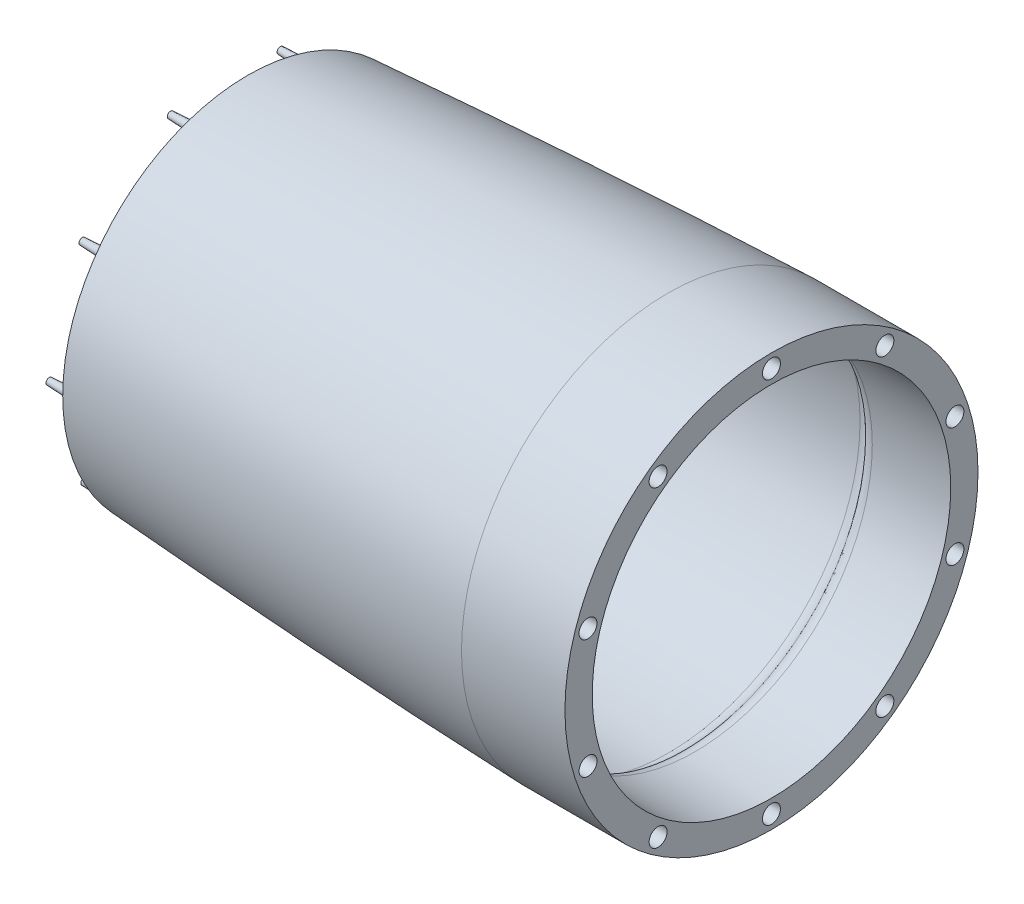
from build123d import *

# Parameters (mm, degrees)
SKETCH2_R                      = 110.114743718
CUT_EXTRUDE1_DEPTH             = 737.012183471
SKETCH5_R                      = 128.800081892
CUT_EXTRUDE2_DEPTH             = 524.976683945
SKETCH6_R                      = 3.81
CUT_EXTRUDE3_DEPTH             = 13.97
SKETCH7_R                      = 1.778
BOSS_EXTRUDE2_DEPTH            = 8.89
BOSS_EXTRUDE2_DRAFT            = 2.5
BOSS_EXTRUDE2_PROFILE_2_DEPTH  = 8.89
BOSS_EXTRUDE2_PROFILE_2_DRAFT  = 2.5
BOSS_EXTRUDE2_PROFILE_3_DEPTH  = 8.89
BOSS_EXTRUDE2_PROFILE_3_DRAFT  = 2.5
BOSS_EXTRUDE2_PROFILE_4_DEPTH  = 8.89
BOSS_EXTRUDE2_PROFILE_4_DRAFT  = 2.5
BOSS_EXTRUDE2_PROFILE_5_DEPTH  = 8.89
BOSS_EXTRUDE2_PROFILE_5_DRAFT  = 2.5
BOSS_EXTRUDE2_PROFILE_6_DEPTH  = 8.89
BOSS_EXTRUDE2_PROFILE_6_DRAFT  = 2.5
BOSS_EXTRUDE2_PROFILE_7_DEPTH  = 8.89
BOSS_EXTRUDE2_PROFILE_7_DRAFT  = 2.5
BOSS_EXTRUDE2_PROFILE_8_DEPTH  = 8.89
BOSS_EXTRUDE2_PROFILE_8_DRAFT  = 2.5
BOSS_EXTRUDE2_PROFILE_9_DEPTH  = 8.89
BOSS_EXTRUDE2_PROFILE_9_DRAFT  = 2.5
BOSS_EXTRUDE2_PROFILE_10_DEPTH = 8.89
BOSS_EXTRUDE2_PROFILE_10_DRAFT = 2.5


with BuildPart() as part:
    # Sketch1 → Revolve1 (revolve)
    with BuildSketch(Plane.XY):
        with BuildLine():
            Line((6.35, 11.460570284), (-259.812483715, 11.460570284))
            add(Edge.make_bspline(
                [(-259.812483715, 11.460570284), (-287.31210638, 10.562340852), (-342.298022137, 8.171569009), (-452.140135716, 1.833524736), (-589.280273052, -8.512118808), (-726.176632388, -21.770900754), (-835.465785428, -34.58872614), (-890.027026607, -41.965202762), (-917.245364413, -46.039623622)],
                knots=[0.121539178, 0.121539178, 0.121539178, 0.121539178, 0.200323508, 0.279107838, 0.436676499, 0.594245159, 0.67302949, 0.75181382, 0.75181382, 0.75181382, 0.75181382], degree=3))
            ThreePointArc((-917.245364413, -46.039623622), (-924.987260279, -50.310773033), (-928.0652, -58.599678629))
            Line((-928.0652, -58.599678629), (-921.7152, -58.599678629))
            ThreePointArc((-921.7152, -58.599678629), (-920.17623014, -54.455225831), (-916.305282206, -52.319651125))
            add(Edge.make_bspline(
                [(-259.605182082, 5.113954963), (-267.127682546, 4.868244998), (-283.42603151, 4.285669281), (-317.270262329, 2.880505646), (-361.130016616, 0.711244662), (-431.275457269, -3.371956494), (-501.372917975, -8.266876273), (-571.414486843, -13.891682648), (-623.914744737, -18.477698889), (-676.380314027, -23.439349795), (-728.80566324, -28.799062072), (-772.453634614, -33.627485173), (-807.34181653, -37.739154543), (-833.490683911, -40.958900147), (-859.619375692, -44.328941115), (-885.723877265, -47.869335132), (-904.612492975, -50.577906922), (-914.800968172, -52.094464395), (-916.305282206, -52.319651125)],
                knots=[0.121539178, 0.121539178, 0.121539178, 0.121539178, 0.143122913, 0.168303261, 0.218663957, 0.269024652, 0.369746043, 0.420106738, 0.470467434, 0.520828129, 0.571188825, 0.62154952, 0.646729868, 0.671910216, 0.697090564, 0.722270911, 0.747451259, 0.75181382, 0.75181382, 0.75181382, 0.75181382], degree=3))
            ThreePointArc((-259.605182082, 5.113954963), (-256.399753184, 4.364993874), (-254, 2.11179575))
            ThreePointArc((-254, 2.11179575), (-251.60858665, -0.136927523), (-248.413737762, -0.890953221))
            add(Edge.make_bspline(
                [(0, 0), (-50.8, 0), (-101.6, 0), (-157.182375328, 0), (-166.747125983, 0), (-181.094251966, 0), (-190.659002621, 0), (-199.585120865, 0), (-207.872606698, 0), (-220.304800851, -0.154959839), (-228.589711976, -0.361524821), (-235.094659099, -0.523710542), (-239.819642219, -0.641517002), (-245.046645359, -0.791480258), (-247.911294959, -0.876040976), (-248.413737762, -0.890953221)],
                knots=[0.761574077, 0.761574077, 0.761574077, 0.761574077, 0.907841521, 0.907841521, 0.921611321, 0.935381121, 0.94915092, 0.94915092, 0.961081918, 0.973012916, 0.984943914, 0.984943914, 0.991748303, 0.998552693, 1, 1, 1, 1], degree=3))
            Line((0, 0), (6.35, 0))
            Line((6.35, 0), (6.35, 11.460570284))
        make_face()
    revolve(axis=Axis((0, -76.2, 0), (-1, 0, 0)))

    # Sketch2 → Cut-Extrude1 (cut, through all)
    with BuildSketch(Plane(origin=(-215.9, 0, 0), x_dir=(0, 0, -1), z_dir=(1, 0, 0))):
        with Locations((0, -76.2)):
            Circle(SKETCH2_R)
    extrude(amount=CUT_EXTRUDE1_DEPTH, mode=Mode.SUBTRACT)

    # Sketch5 → Cut-Extrude2 (cut, through all)
    with BuildSketch(Plane(origin=(-438.15, 0, 0), x_dir=(0, 0, -1), z_dir=(1, 0, 0))):
        with Locations((0, -76.2)):
            Circle(SKETCH5_R)
    extrude(amount=-CUT_EXTRUDE2_DEPTH, mode=Mode.SUBTRACT)

    # Sketch6 → Cut-Extrude3 (cut)
    with BuildSketch(Plane(origin=(-215.9, 0, 0), x_dir=(0, 0, -1), z_dir=(1, 0, 0))):
        with Locations((0, 5.676206313)):
            Circle(SKETCH6_R)
        with Locations((48.125626585, -9.960757658)):
            Circle(SKETCH6_R)
        with Locations((77.868899544, -50.898860814)):
            Circle(SKETCH6_R)
        with Locations((77.868899544, -101.501139186)):
            Circle(SKETCH6_R)
        with Locations((48.125626585, -142.439242342)):
            Circle(SKETCH6_R)
        with Locations((0, -158.076206313)):
            Circle(SKETCH6_R)
        with Locations((-48.125626585, -142.439242342)):
            Circle(SKETCH6_R)
        with Locations((-77.868899544, -101.501139186)):
            Circle(SKETCH6_R)
        with Locations((-77.868899544, -50.898860814)):
            Circle(SKETCH6_R)
        with Locations((-48.125626585, -9.960757658)):
            Circle(SKETCH6_R)
    extrude(amount=-CUT_EXTRUDE3_DEPTH, mode=Mode.SUBTRACT)


with BuildPart() as boss_extrude2_tool:
    # Sketch7 → Boss-Extrude2 (with draft: the straight prism first)
    with BuildSketch(Plane.ZY.offset(438.15)):
        with Locations((23.926020811, -4.692661383)):
            Circle(SKETCH7_R)
    extrude(amount=BOSS_EXTRUDE2_DEPTH)
    # Boss-Extrude2: the draft: its side faces are tilted about the plane it starts from
    boss_extrude2_sides = [boss_extrude2_tool.faces().sort_by_distance(p)[0] for p in [
        (-442.595, -4.692661383, 22.148020811),
    ]]
    draft(boss_extrude2_sides, Plane.ZY.offset(438.15), BOSS_EXTRUDE2_DRAFT)


with BuildPart() as part_1:
    add(part.part)

    # Boss-Extrude2: add boss_extrude2_tool
    add(boss_extrude2_tool.part)


with BuildPart() as boss_extrude2_profile_2_tool:
    # Sketch7 → Boss-Extrude2 profile 2 (with draft: the straight prism first)
    with BuildSketch(Plane.ZY.offset(438.15)):
        with Locations((61.387516514, -32.412710015)):
            Circle(SKETCH7_R)
    extrude(amount=BOSS_EXTRUDE2_PROFILE_2_DEPTH)
    # Boss-Extrude2 profile 2: the draft: its side faces are tilted about the plane it starts from
    boss_extrude2_profile_2_sides = [boss_extrude2_profile_2_tool.faces().sort_by_distance(p)[0] for p in [
        (-442.595, -32.412710015, 59.609516514),
    ]]
    draft(boss_extrude2_profile_2_sides, Plane.ZY.offset(438.15), BOSS_EXTRUDE2_PROFILE_2_DRAFT)


with BuildPart() as part_2:
    add(part_1.part)

    # Boss-Extrude2 profile 2: add boss_extrude2_profile_2_tool
    add(boss_extrude2_profile_2_tool.part)


with BuildPart() as boss_extrude2_profile_3_tool:
    # Sketch7 → Boss-Extrude2 profile 3 (with draft: the straight prism first)
    with BuildSketch(Plane.ZY.offset(438.15)):
        with Locations((75.401067393, -76.858015146)):
            Circle(SKETCH7_R)
    extrude(amount=BOSS_EXTRUDE2_PROFILE_3_DEPTH)
    # Boss-Extrude2 profile 3: the draft: its side faces are tilted about the plane it starts from
    boss_extrude2_profile_3_sides = [boss_extrude2_profile_3_tool.faces().sort_by_distance(p)[0] for p in [
        (-442.595, -76.858015146, 73.623067393),
    ]]
    draft(boss_extrude2_profile_3_sides, Plane.ZY.offset(438.15), BOSS_EXTRUDE2_PROFILE_3_DRAFT)


with BuildPart() as part_3:
    add(part_2.part)

    # Boss-Extrude2 profile 3: add boss_extrude2_profile_3_tool
    add(boss_extrude2_profile_3_tool.part)


with BuildPart() as boss_extrude2_profile_4_tool:
    # Sketch7 → Boss-Extrude2 profile 4 (with draft: the straight prism first)
    with BuildSketch(Plane.ZY.offset(438.15)):
        with Locations((60.613973316, -121.051980857)):
            Circle(SKETCH7_R)
    extrude(amount=BOSS_EXTRUDE2_PROFILE_4_DEPTH)
    # Boss-Extrude2 profile 4: the draft: its side faces are tilted about the plane it starts from
    boss_extrude2_profile_4_sides = [boss_extrude2_profile_4_tool.faces().sort_by_distance(p)[0] for p in [
        (-442.595, -121.051980857, 58.835973316),
    ]]
    draft(boss_extrude2_profile_4_sides, Plane.ZY.offset(438.15), BOSS_EXTRUDE2_PROFILE_4_DRAFT)


with BuildPart() as part_4:
    add(part_3.part)

    # Boss-Extrude2 profile 4: add boss_extrude2_profile_4_tool
    add(boss_extrude2_profile_4_tool.part)


with BuildPart() as boss_extrude2_profile_5_tool:
    # Sketch7 → Boss-Extrude2 profile 5 (with draft: the straight prism first)
    with BuildSketch(Plane.ZY.offset(438.15)):
        with Locations((22.674401626, -148.114014343)):
            Circle(SKETCH7_R)
    extrude(amount=BOSS_EXTRUDE2_PROFILE_5_DEPTH)
    # Boss-Extrude2 profile 5: the draft: its side faces are tilted about the plane it starts from
    boss_extrude2_profile_5_sides = [boss_extrude2_profile_5_tool.faces().sort_by_distance(p)[0] for p in [
        (-442.595, -148.114014343, 20.896401626),
    ]]
    draft(boss_extrude2_profile_5_sides, Plane.ZY.offset(438.15), BOSS_EXTRUDE2_PROFILE_5_DRAFT)


with BuildPart() as part_5:
    add(part_4.part)

    # Boss-Extrude2 profile 5: add boss_extrude2_profile_5_tool
    add(boss_extrude2_profile_5_tool.part)


with BuildPart() as boss_extrude2_profile_6_tool:
    # Sketch7 → Boss-Extrude2 profile 6 (with draft: the straight prism first)
    with BuildSketch(Plane.ZY.offset(438.15)):
        with Locations((-23.926020811, -147.707338617)):
            Circle(SKETCH7_R)
    extrude(amount=BOSS_EXTRUDE2_PROFILE_6_DEPTH)
    # Boss-Extrude2 profile 6: the draft: its side faces are tilted about the plane it starts from
    boss_extrude2_profile_6_sides = [boss_extrude2_profile_6_tool.faces().sort_by_distance(p)[0] for p in [
        (-442.595, -147.707338617, -25.704020811),
    ]]
    draft(boss_extrude2_profile_6_sides, Plane.ZY.offset(438.15), BOSS_EXTRUDE2_PROFILE_6_DRAFT)


with BuildPart() as part_6:
    add(part_5.part)

    # Boss-Extrude2 profile 6: add boss_extrude2_profile_6_tool
    add(boss_extrude2_profile_6_tool.part)


with BuildPart() as boss_extrude2_profile_7_tool:
    # Sketch7 → Boss-Extrude2 profile 7 (with draft: the straight prism first)
    with BuildSketch(Plane.ZY.offset(438.15)):
        with Locations((-61.387516514, -119.987289985)):
            Circle(SKETCH7_R)
    extrude(amount=BOSS_EXTRUDE2_PROFILE_7_DEPTH)
    # Boss-Extrude2 profile 7: the draft: its side faces are tilted about the plane it starts from
    boss_extrude2_profile_7_sides = [boss_extrude2_profile_7_tool.faces().sort_by_distance(p)[0] for p in [
        (-442.595, -119.987289985, -63.165516514),
    ]]
    draft(boss_extrude2_profile_7_sides, Plane.ZY.offset(438.15), BOSS_EXTRUDE2_PROFILE_7_DRAFT)


with BuildPart() as part_7:
    add(part_6.part)

    # Boss-Extrude2 profile 7: add boss_extrude2_profile_7_tool
    add(boss_extrude2_profile_7_tool.part)


with BuildPart() as boss_extrude2_profile_8_tool:
    # Sketch7 → Boss-Extrude2 profile 8 (with draft: the straight prism first)
    with BuildSketch(Plane.ZY.offset(438.15)):
        with Locations((-75.401067393, -75.541984854)):
            Circle(SKETCH7_R)
    extrude(amount=BOSS_EXTRUDE2_PROFILE_8_DEPTH)
    # Boss-Extrude2 profile 8: the draft: its side faces are tilted about the plane it starts from
    boss_extrude2_profile_8_sides = [boss_extrude2_profile_8_tool.faces().sort_by_distance(p)[0] for p in [
        (-442.595, -75.541984854, -77.179067393),
    ]]
    draft(boss_extrude2_profile_8_sides, Plane.ZY.offset(438.15), BOSS_EXTRUDE2_PROFILE_8_DRAFT)


with BuildPart() as part_8:
    add(part_7.part)

    # Boss-Extrude2 profile 8: add boss_extrude2_profile_8_tool
    add(boss_extrude2_profile_8_tool.part)


with BuildPart() as boss_extrude2_profile_9_tool:
    # Sketch7 → Boss-Extrude2 profile 9 (with draft: the straight prism first)
    with BuildSketch(Plane.ZY.offset(438.15)):
        with Locations((-60.613973316, -31.348019143)):
            Circle(SKETCH7_R)
    extrude(amount=BOSS_EXTRUDE2_PROFILE_9_DEPTH)
    # Boss-Extrude2 profile 9: the draft: its side faces are tilted about the plane it starts from
    boss_extrude2_profile_9_sides = [boss_extrude2_profile_9_tool.faces().sort_by_distance(p)[0] for p in [
        (-442.595, -31.348019143, -62.391973316),
    ]]
    draft(boss_extrude2_profile_9_sides, Plane.ZY.offset(438.15), BOSS_EXTRUDE2_PROFILE_9_DRAFT)


with BuildPart() as part_9:
    add(part_8.part)

    # Boss-Extrude2 profile 9: add boss_extrude2_profile_9_tool
    add(boss_extrude2_profile_9_tool.part)


with BuildPart() as boss_extrude2_profile_10_tool:
    # Sketch7 → Boss-Extrude2 profile 10 (with draft: the straight prism first)
    with BuildSketch(Plane.ZY.offset(438.15)):
        with Locations((-22.674401626, -4.285985657)):
            Circle(SKETCH7_R)
    extrude(amount=BOSS_EXTRUDE2_PROFILE_10_DEPTH)
    # Boss-Extrude2 profile 10: the draft: its side faces are tilted about the plane it starts from
    boss_extrude2_profile_10_sides = [boss_extrude2_profile_10_tool.faces().sort_by_distance(p)[0] for p in [
        (-442.595, -4.285985657, -24.452401626),
    ]]
    draft(boss_extrude2_profile_10_sides, Plane.ZY.offset(438.15), BOSS_EXTRUDE2_PROFILE_10_DRAFT)


with BuildPart() as part_10:
    add(part_9.part)

    # Boss-Extrude2 profile 10: add boss_extrude2_profile_10_tool
    add(boss_extrude2_profile_10_tool.part)


solid = part_10.part
